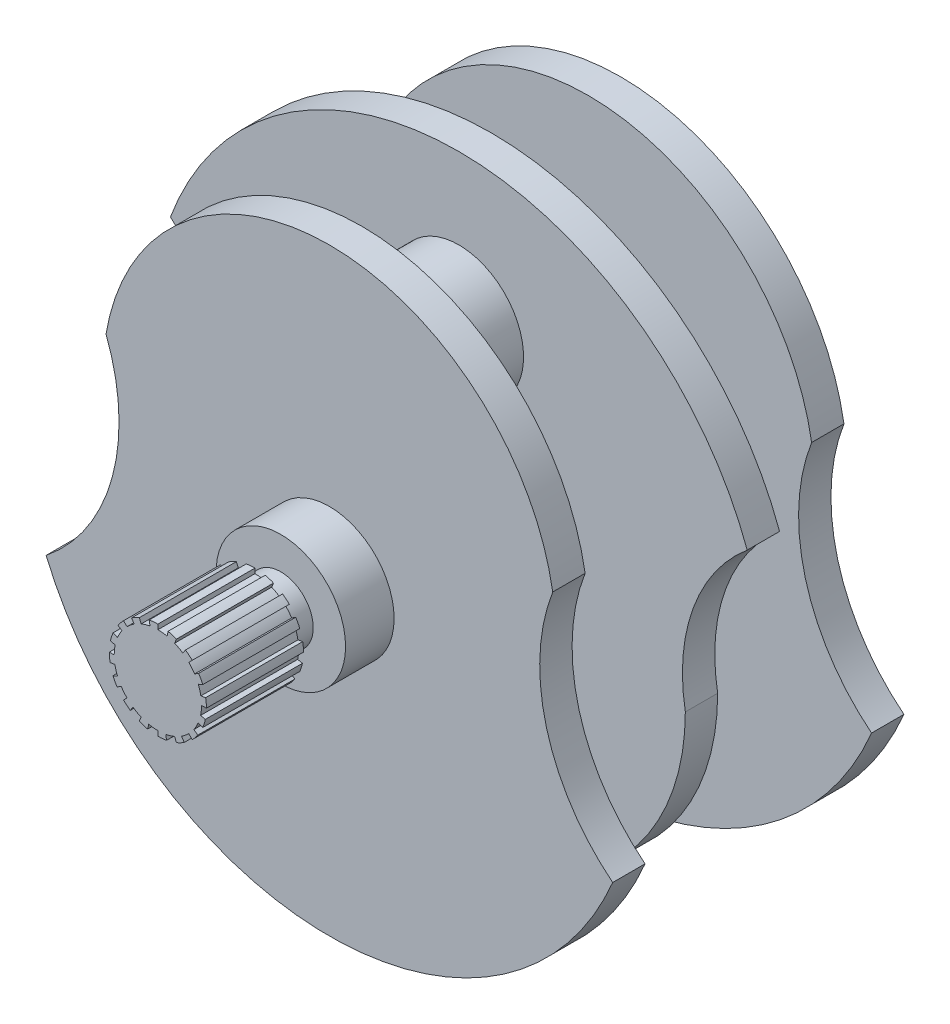
from build123d import *

# Parameters (mm, degrees)
SKETCH1_R            = 20
BOSS_EXTRUDE1_DEPTH  = 15
SKETCH2_R            = 10
BOSS_EXTRUDE2_DEPTH  = 8
SKETCH3_R            = 15
BOSS_EXTRUDE3_DEPTH  = 30
CUT_EXTRUDE1_REACH   = 62.075
CIRPATTERN1_COUNT    = 16
BOSS_EXTRUDE5_DEPTH  = 10
SKETCH9_R            = 20
BOSS_EXTRUDE6_DEPTH  = 30
BOSS_EXTRUDE7_DEPTH  = 10
BOSS_EXTRUDE8_DEPTH  = 10
BOSS_EXTRUDE9_REACH  = 168.067
SKETCH14_R           = 20
SKETCH15_R           = 20
BOSS_EXTRUDE10_DEPTH = 15
SKETCH16_R           = 10
BOSS_EXTRUDE11_DEPTH = 8


with BuildPart() as part:
    # Sketch1 → Boss-Extrude1 (new body)
    with BuildSketch(Plane.XY):
        Circle(SKETCH1_R)
    extrude(amount=BOSS_EXTRUDE1_DEPTH)

    # Sketch2 → Boss-Extrude2 (add)
    with BuildSketch(Plane.XY.offset(15)):
        Circle(SKETCH2_R)
    extrude(amount=BOSS_EXTRUDE2_DEPTH)

    # Sketch3 → Boss-Extrude3 (add)
    with BuildSketch(Plane.XY.offset(23)):
        Circle(SKETCH3_R)
    extrude(amount=BOSS_EXTRUDE3_DEPTH)

    # Sketch5 → Cut-Extrude1 (cut, up to next)
    with BuildSketch(Plane.XY.offset(53), mode=Mode.PRIVATE) as cut_extrude1_sk1:
        with BuildLine():
            ThreePointArc((3.157894737, 14.663822859), (1.587869189, 14.915718938), (0, 15))
            Line((0, 15), (0, 13.5))
            ThreePointArc((0, 13.5), (1.42908227, 13.424147044), (2.842105263, 13.197440573))
            Line((2.842105263, 13.197440573), (3.157894737, 14.663822859))
        make_face()
    cut_extrude1_tool1 = extrude(cut_extrude1_sk1.sketch, amount=-CUT_EXTRUDE1_REACH, mode=Mode.PRIVATE) & part.part
    cut_extrude1 = cut_extrude1_tool1.solids().sort_by_distance((1.50704, 14.156443, 53))[0]
    add(cut_extrude1, mode=Mode.SUBTRACT)

    # CirPattern1: Cut-Extrude1 ×16 about axis
    cirpattern1_axis = Axis((0, 0, 53), (0, 0, 1))
    for i in range(1, CIRPATTERN1_COUNT):
        add(cut_extrude1.rotate(cirpattern1_axis, i * 360 / CIRPATTERN1_COUNT), mode=Mode.SUBTRACT)

    # Sketch8 → Boss-Extrude5 (add)
    with BuildSketch(Plane(origin=(0, 0, 0), x_dir=(-1, 0, 0), z_dir=(0, 0, -1))):
        with BuildLine():
            ThreePointArc((69.029343124, 31.616789051), (0, 90), (-69.029343124, 31.616789051))
            ThreePointArc((-69.029343124, 31.616789051), (-67.080083863, -5.661523384), (-87.55021137, -36.877642129))
            ThreePointArc((-87.55021137, -36.877642129), (0, -95), (87.55021137, -36.877642129))
            ThreePointArc((87.55021137, -36.877642129), (67.080083863, -5.661523384), (69.029343124, 31.616789051))
        make_face()
    extrude(amount=BOSS_EXTRUDE5_DEPTH)

    # Sketch9 → Boss-Extrude6 (add)
    with BuildSketch(Plane(origin=(0, 0, -10), x_dir=(-1, 0, 0), z_dir=(0, 0, -1))):
        with Locations((0, 50)):
            Circle(SKETCH9_R)
    extrude(amount=BOSS_EXTRUDE6_DEPTH)

    # Sketch10 → Boss-Extrude7 (add)
    with BuildSketch(Plane(origin=(0, 0, -40), x_dir=(-1, 0, 0), z_dir=(0, 0, -1))):
        with BuildLine():
            ThreePointArc((-70, -20), (0, -90), (70, -20))
            ThreePointArc((70, -20), (72.432874235, 9.018340852), (89.130077464, 32.875968295))
            ThreePointArc((89.130077464, 32.875968295), (0, 95), (-89.130077464, 32.875968295))
            ThreePointArc((-89.130077464, 32.875968295), (-72.432874235, 9.018340852), (-70, -20))
        make_face()
    extrude(amount=BOSS_EXTRUDE7_DEPTH)


with BuildPart() as body_2:
    # Sketch12 → Boss-Extrude8 (new body)
    with BuildSketch(Plane(origin=(0, 0, -80), x_dir=(-1, 0, 0), z_dir=(0, 0, -1))):
        with BuildLine():
            ThreePointArc((69.029343124, 31.616789051), (0, 90), (-69.029343124, 31.616789051))
            ThreePointArc((-69.029343124, 31.616789051), (-67.080083863, -5.661523384), (-87.55021137, -36.877642129))
            ThreePointArc((-87.55021137, -36.877642129), (0, -95), (87.55021137, -36.877642129))
            ThreePointArc((87.55021137, -36.877642129), (67.080083863, -5.661523384), (69.029343124, 31.616789051))
        make_face()
    extrude(amount=BOSS_EXTRUDE8_DEPTH)

    # Sketch14 → Boss-Extrude9 (add, up to next)
    with BuildSketch(Plane(origin=(0, 0, -50), x_dir=(-1, 0, 0), z_dir=(0, 0, -1)), mode=Mode.PRIVATE) as boss_extrude9_sk1:
        with Locations((0, -50)):
            Circle(SKETCH14_R)
    boss_extrude9_tool1 = extrude(boss_extrude9_sk1.sketch, amount=BOSS_EXTRUDE9_REACH, mode=Mode.PRIVATE) - body_2.part

    add(part.part)  # Boss-Extrude9 merges part
    add(boss_extrude9_tool1.solids().sort_by_distance((0, -50, -50))[0])

    # Sketch15 → Boss-Extrude10 (add)
    with BuildSketch(Plane(origin=(0, 0, -90), x_dir=(-1, 0, 0), z_dir=(0, 0, -1))):
        Circle(SKETCH15_R)
    extrude(amount=BOSS_EXTRUDE10_DEPTH)

    # Sketch16 → Boss-Extrude11 (add)
    with BuildSketch(Plane(origin=(0, 0, -105), x_dir=(-1, 0, 0), z_dir=(0, 0, -1))):
        Circle(SKETCH16_R)
    extrude(amount=BOSS_EXTRUDE11_DEPTH)


solid = body_2.part
